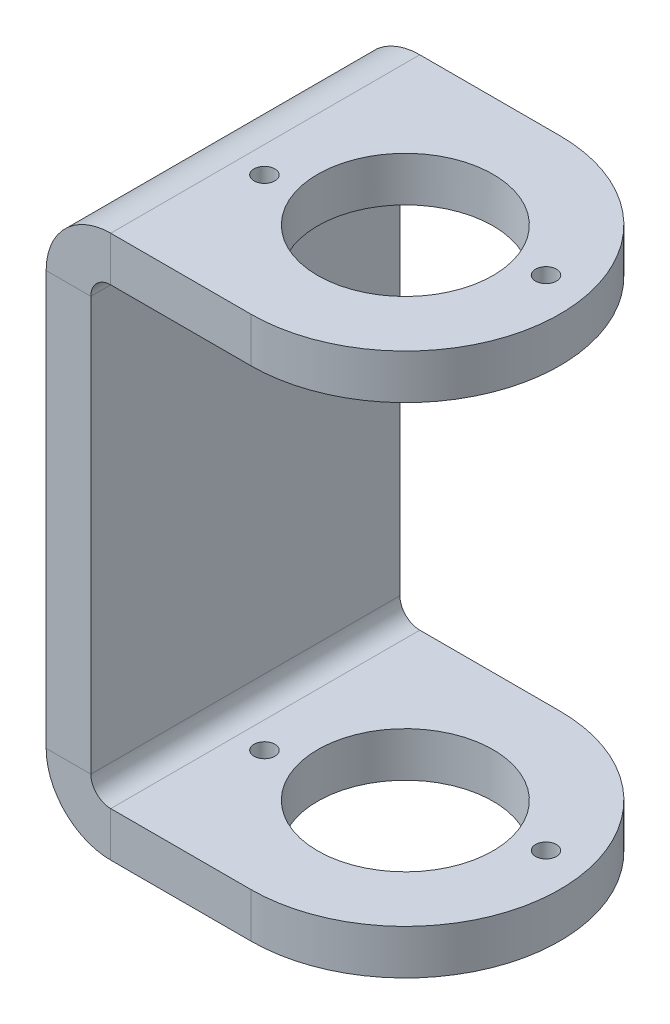
from build123d import *

# Parameters (mm, degrees)
BASE_FLANGE1_DEPTH        = 18.5
FILLET3_RADIUS            = 18.5
FILLET3_LENGTH            = 5.35
FILLET4_RADIUS            = 18.5
FILLET4_LENGTH            = 5.35
CUT_EXTRUDE6_DEPTH        = 57.986840586
CUT_EXTRUDE6_DEPTH_BACK   = 57.986840586
SKETCH23_R                = 10.5
M3X0_5_TAPPED_HOLE1_D     = 2.5
M3X0_5_TAPPED_HOLE1_DEPTH = 5.35
M3X0_5_TAPPED_HOLE2_D     = 2.5


# Sheet-metal steps are written as plain solids
with BuildPart() as part:
    # Sketch20 → Base-Flange1 (new, symmetric)
    with BuildSketch(Plane.XY):
        with BuildLine():
            Line((43, -32.5), (7.730000066, -32.5))
            ThreePointArc((7.730000066, -32.5), (2.264064601, -30.235935399), (0, -24.769999934))
            Line((0, -24.769999934), (0, 24.769999934))
            ThreePointArc((0, 24.769999934), (2.264064601, 30.235935399), (7.730000066, 32.5))
            Line((7.730000066, 32.5), (43, 32.5))
            Line((43, 32.5), (43, 27.15))
            Line((43, 27.15), (7.730000066, 27.15))
            ThreePointArc((7.730000066, 27.15), (6.04708588, 26.45291412), (5.35, 24.769999934))
            Line((5.35, 24.769999934), (5.35, -24.769999934))
            ThreePointArc((5.35, -24.769999934), (6.04708588, -26.45291412), (7.730000066, -27.15))
            Line((7.730000066, -27.15), (43, -27.15))
            Line((43, -27.15), (43, -32.5))
        make_face()
    extrude(amount=BASE_FLANGE1_DEPTH, both=True)

    # Fillet3: full round fillet: the end face becomes a half cylinder, R = half its width
    fillet3_face = Plane((43, 29.825, 0), x_dir=(0, 1, 0), z_dir=(1, 0, 0))  # on the end face: x along it, z out of the body
    fillet3_slab = fillet3_face.offset(-FILLET3_RADIUS / 2) * Box(FILLET3_LENGTH, 2 * FILLET3_RADIUS, FILLET3_RADIUS, mode=Mode.PRIVATE)  # the body's end, R deep
    fillet3_round = Plane((24.5, 29.825, 0), x_dir=(1, 0, 0), z_dir=(0, 1, 0)) * Cylinder(FILLET3_RADIUS, FILLET3_LENGTH, mode=Mode.PRIVATE)  # its axis R under the face
    add(fillet3_slab - fillet3_round, mode=Mode.SUBTRACT)

    # Fillet4: full round fillet: the end face becomes a half cylinder, R = half its width
    fillet4_face = Plane((43, -29.825, 0), x_dir=(0, 1, 0), z_dir=(1, 0, 0))  # on the end face: x along it, z out of the body
    fillet4_slab = fillet4_face.offset(-FILLET4_RADIUS / 2) * Box(FILLET4_LENGTH, 2 * FILLET4_RADIUS, FILLET4_RADIUS, mode=Mode.PRIVATE)  # the body's end, R deep
    fillet4_round = Plane((24.5, -29.825, 0), x_dir=(1, 0, 0), z_dir=(0, 1, 0)) * Cylinder(FILLET4_RADIUS, FILLET4_LENGTH, mode=Mode.PRIVATE)  # its axis R under the face
    add(fillet4_slab - fillet4_round, mode=Mode.SUBTRACT)

    # Sketch23 → Cut-Extrude6 (cut, two sides: drawn at the far end of the back side and taken through both)
    with BuildSketch(Plane(origin=(0, 0, 0), x_dir=(1, 0, 0), z_dir=(0, 1, 0)).offset(-CUT_EXTRUDE6_DEPTH_BACK)):
        with Locations(Location((24.5, 0, 0), (0, 0, 270))):
            Circle(SKETCH23_R)
    extrude(amount=CUT_EXTRUDE6_DEPTH + CUT_EXTRUDE6_DEPTH_BACK, mode=Mode.SUBTRACT)

    # M3x0.5 Tapped Hole1
    with Locations(Plane(origin=(0, 32.5, 0), x_dir=(1, 0, 0), z_dir=(0, 1, 0))):
        with Locations((38.127028289, 3.21), (10.882456169, -3.25)):
            Hole(M3X0_5_TAPPED_HOLE1_D / 2, depth=M3X0_5_TAPPED_HOLE1_DEPTH)

    # M3x0.5 Tapped Hole2 (through all)
    with Locations(Plane(origin=(0, -32.5, 0), x_dir=(-1, 0, 0), z_dir=(0, -1, 0))):
        with Locations((-10.882456169, -3.25), (-38.127028289, 3.21)):
            Hole(M3X0_5_TAPPED_HOLE2_D / 2)


solid = part.part
